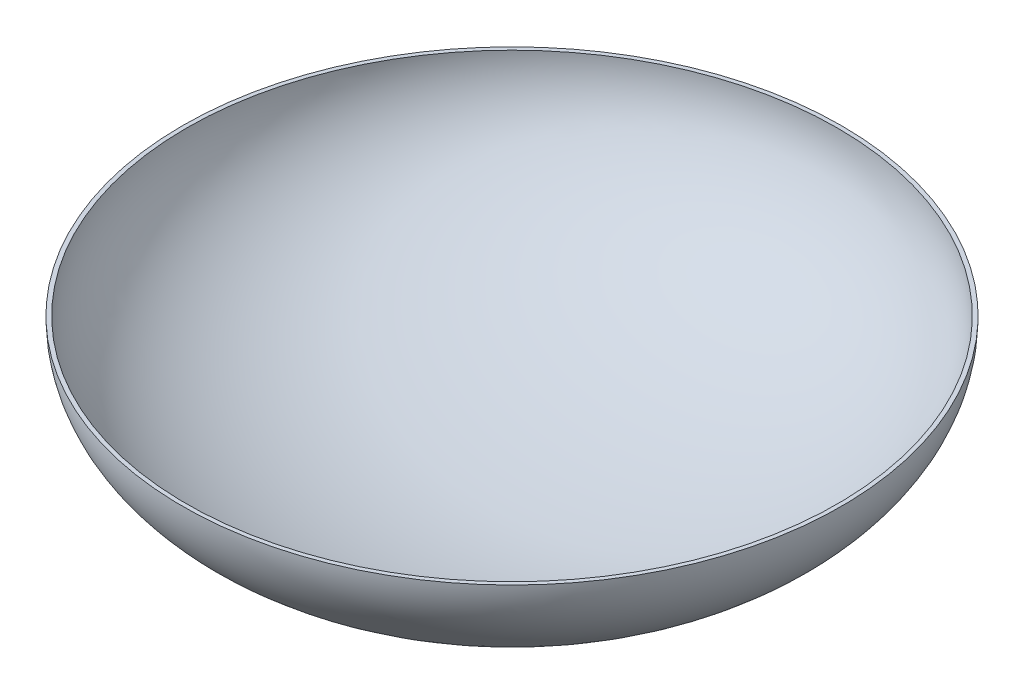
from build123d import *


with BuildPart() as part:
    # Sketch1 → Revolve1 (revolve)
    with BuildSketch(Plane.XY):
        with BuildLine():
            Line((0, 0), (0, -1.27))
            add(Edge.make_bspline(
                [(-102.87, 50.8), (-102.87, 47.309953824), (-101.488553688, 40.329861472), (-93.439895195, 27.090458381), (-74.260533056, 12.778806664), (-40.142161563, 1.390302517), (-13.380720521, -1.27), (0, -1.27)],
                knots=[3.141592654, 3.141592654, 3.141592654, 3.141592654, 3.337942194, 3.534291735, 3.926990817, 4.319689899, 4.71238898, 4.71238898, 4.71238898, 4.71238898], degree=3))
            Line((-102.87, 50.8), (-101.6, 50.8))
            add(Edge.make_bspline(
                [(-101.6, 50.8), (-101.6, 0), (0, 0)],
                knots=[3.141592654, 3.141592654, 3.141592654, 4.71238898, 4.71238898, 4.71238898], degree=2, weights=[1, 0.707106781, 1]))
        make_face()
    revolve(axis=Axis((0, 50.8, 0), (0, 1, 0)))


solid = part.part
